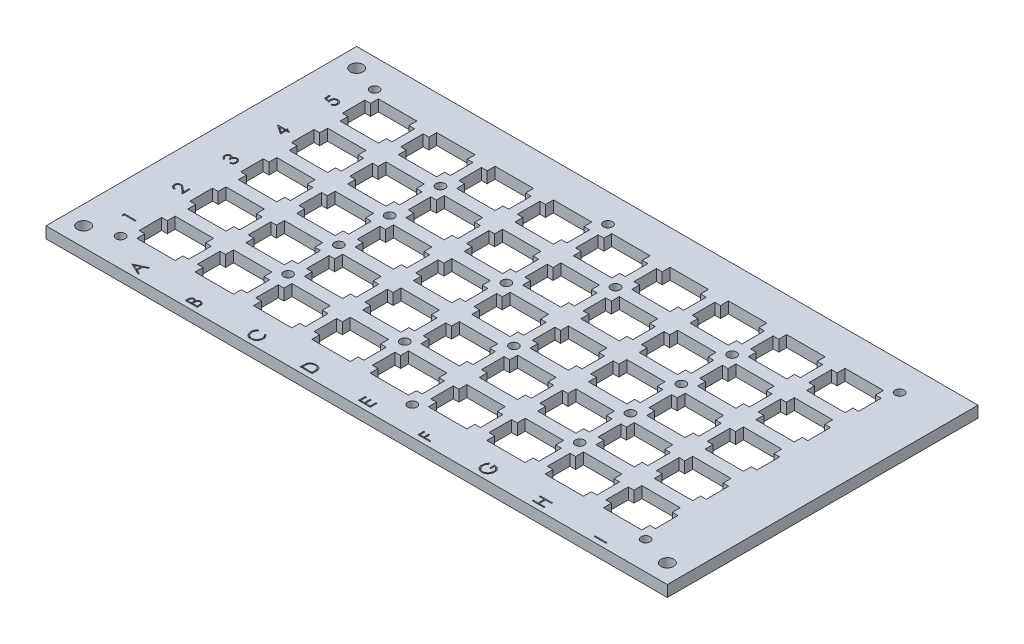
from build123d import *

# Parameters (mm, degrees)
SKETCH1_W                 = 195.1
SKETCH1_H                 = 112.55
BOSS_EXTRUDE1_DEPTH       = 8
SKETCH2_W                 = 10.2
SKETCH2_H                 = 10.2
SKETCH2_W_2               = 1.5
SKETCH2_H_2               = 6
CUT_EXTRUDE1_DEPTH        = 3
SKETCH3_R                 = 1.25
CUT_EXTRUDE2_DEPTH        = 224.844011906
LPATTERN1_COUNT           = 9
LPATTERN1_PITCH           = 15.5
LPATTERN1_COUNT_DIR2      = 5
LPATTERN1_PITCH_DIR2      = 13.5
CUT_EXTRUDE4_DEPTH        = 224.931109197
CUT_EXTRUDE4_DEPTH_BACK   = 224.931109197
SKETCH5_W                 = 195.1
SKETCH5_H                 = 112.55
SKETCH5_W_2               = 165.1
SKETCH5_H_2               = 82.55
F_1_8_0_133_DOWEL_HOLE1_D = 3.3782
M2_CLEARANCE_HOLE1_D      = 2.4
SKETCH14_W                = 3.175
SKETCH14_H                = 0.284935898
CUT_EXTRUDE7_DEPTH        = 0.8
SKETCH15_W                = 165.1
SKETCH15_H                = 82.55
CUT_EXTRUDE8_DEPTH        = 10


with BuildPart() as part:
    # Sketch1 → Boss-Extrude1 (new body)
    with BuildSketch(Plane(origin=(0, 0, 0), x_dir=(1, 0, 0), z_dir=(0, 1, 0))):
        with Locations((96.157910906, -55.789208909)):
            Rectangle(SKETCH1_W, SKETCH1_H)
    extrude(amount=BOSS_EXTRUDE1_DEPTH)

    # Sketch2 → Cut-Extrude1 (cut)
    with BuildSketch(Plane(origin=(0, 8, 0), x_dir=(1, 0, 0), z_dir=(0, 1, 0))):
        with Locations((20.857910906, -18.964208909)):
            Rectangle(SKETCH2_W, SKETCH2_H)
        with Locations((15.007910906, -18.964208909)):
            Rectangle(SKETCH2_W_2, SKETCH2_H_2)
        with Locations((26.707910906, -18.964208909)):
            Rectangle(SKETCH2_W_2, SKETCH2_H_2)
    cut_extrude1 = extrude(amount=-CUT_EXTRUDE1_DEPTH, mode=Mode.SUBTRACT)

    # Sketch3 → Cut-Extrude2 (cut, through all)
    with BuildSketch(Plane(origin=(0, 5, 0), x_dir=(1, 0, 0), z_dir=(0, 1, 0))):
        with Locations(Location((21.357910906, -18.964208909, 0), (0, 0, 270))):
            Circle(SKETCH3_R)
    cut_extrude2 = extrude(amount=-CUT_EXTRUDE2_DEPTH, mode=Mode.SUBTRACT)

    # LPattern1: Cut-Extrude1, Cut-Extrude2 9 × 5
    with Locations(*[(i * LPATTERN1_PITCH, 0, j * LPATTERN1_PITCH_DIR2) for i in range(LPATTERN1_COUNT) for j in range(LPATTERN1_COUNT_DIR2) if (i, j) != (0, 0)]):
        add(cut_extrude1, mode=Mode.SUBTRACT)
        add(cut_extrude2, mode=Mode.SUBTRACT)

    # Sketch5 → Cut-Extrude4 (cut, two sides: drawn at the far end of the back side and taken through both)
    with BuildSketch(Plane(origin=(0, 8, 0), x_dir=(1, 0, 0), z_dir=(0, 1, 0)).offset(-CUT_EXTRUDE4_DEPTH_BACK)):
        with Locations((96.157910906, -55.789208909)):
            Rectangle(SKETCH5_W, SKETCH5_H)
        with Locations((83.357910906, -45.964208909)):
            Rectangle(SKETCH5_W_2, SKETCH5_H_2, mode=Mode.SUBTRACT)
    extrude(amount=CUT_EXTRUDE4_DEPTH + CUT_EXTRUDE4_DEPTH_BACK, mode=Mode.SUBTRACT)

    # 1/8 (0.133) Dowel Hole1 (through all)
    with Locations(Plane(origin=(0, 8, 0), x_dir=(1, 0, 0), z_dir=(0, 1, 0))):
        with Locations((5.807910906, -9.689208909), (5.807910906, -82.239208909), (160.907910906, -82.239208909)):
            Hole(F_1_8_0_133_DOWEL_HOLE1_D / 2)

    # M2 Clearance Hole1 (through all)
    with Locations(Plane(origin=(0, 8, 0), x_dir=(1, 0, 0), z_dir=(0, 1, 0))):
        with Locations((13.107910906, -79.714208909), (13.107910906, -12.214208909), (44.107910906, -66.214208909), (44.107910906, -52.714208909), (44.107910906, -39.214208909), (44.107910906, -25.714208909), (152.607910906, -79.714208909), (152.607910906, -12.214208909), (121.607910906, -66.214208909), (121.607910906, -52.714208909), (121.607910906, -39.214208909), (121.607910906, -25.714208909), (90.607910906, -25.714208909), (75.107910906, -39.214208909), (90.607910906, -52.714208909), (75.107910906, -66.214208909), (90.607910906, -79.714208909), (75.107910906, -12.214208909)):
            Hole(M2_CLEARANCE_HOLE1_D / 2)

    # Sketch14 → Cut-Extrude7 (cut)
    # profile 1 of 14: a face of its own
    with BuildSketch(Plane(origin=(0, 8, 0), x_dir=(1, 0, 0), z_dir=(0, 1, 0))):
        Polygon((8.415036229, -74.632838521), (8.415036229, -74.04579425), (11.590036229, -74.04579425), (11.590036229, -74.330730148), (8.740677255, -74.330730148), (8.740677255, -74.819191686), align=None)
    # profile 2 of 14: a face of its own
    with BuildSketch(Plane(origin=(0, 8, 0), x_dir=(1, 0, 0), z_dir=(0, 1, 0))):
        with BuildLine():
            Line((9.391959306, -61.467909635), (9.391959306, -61.752845532))
            add(Edge.make_bspline(
                [(9.391959306, -61.752845532), (9.354157858, -61.750988472), (9.27991682, -61.747341255), (9.17167299, -61.730261307), (9.068208994, -61.705822083), (8.970355572, -61.671267692), (8.877247512, -61.62835414), (8.78925464, -61.576891901), (8.706712633, -61.51593748), (8.630386683, -61.446807085), (8.560366529, -61.371724106), (8.499900702, -61.290710861), (8.448812528, -61.205580014), (8.406103116, -61.116589845), (8.374044827, -61.022736334), (8.350258054, -60.92487117), (8.335946655, -60.822564382), (8.334408335, -60.752859505), (8.333625973, -60.717408834)],
                knots=[0, 0, 0, 0, 1.10065271, 2.161652631, 3.183658789, 4.190468796, 5.17591951, 6.163126047, 7.15150782, 8.156236427, 9.156009102, 10.134482811, 11.092018607, 12.041330605, 13.001268258, 13.972401359, 14.968799086, 16, 16, 16, 16], degree=3))
            add(Edge.make_bspline(
                [(8.333625973, -60.717408834), (8.334434387, -60.682591988), (8.336022892, -60.61417813), (8.349869677, -60.514370819), (8.371088641, -60.419130707), (8.402531803, -60.329537151), (8.441986092, -60.244670667), (8.491052671, -60.165582045), (8.547409872, -60.090358838), (8.613885955, -60.022692871), (8.684816104, -59.960533517), (8.760568906, -59.906955912), (8.838899636, -59.860814457), (8.92042017, -59.823049118), (9.00539598, -59.794421311), (9.093012373, -59.77321085), (9.184280502, -59.761085804), (9.246064654, -59.75923514), (9.277476133, -59.75829425)],
                knots=[0, 0, 0, 0, 1.111674182, 2.184400057, 3.212814286, 4.223731311, 5.211378316, 6.196328225, 7.191884489, 8.207283132, 9.220262353, 10.201199469, 11.166417575, 12.120932471, 13.06540007, 14.026332106, 14.996573967, 16, 16, 16, 16], degree=3))
            add(Edge.make_bspline(
                [(9.277476133, -59.75829425), (9.321697364, -59.759830306), (9.409363806, -59.762875461), (9.538191853, -59.788923149), (9.663007678, -59.829606688), (9.763465655, -59.878585663), (9.844405518, -59.928009668), (9.911080305, -59.972503325), (9.982852234, -60.024886735), (10.0600118, -60.084712357), (10.141548533, -60.153010472), (10.229126002, -60.228006704), (10.32112484, -60.311637858), (10.384002221, -60.370283403), (10.416583705, -60.400672055)],
                knots=[0, 0, 0, 0, 1.184416499, 2.348048165, 3.509039915, 4.696071444, 5.333504901, 6.05069495, 6.844171097, 7.714965912, 8.667477798, 9.695072654, 10.805644396, 12, 12, 12, 12], degree=3))
            Line((10.416583705, -60.400672055), (11.264395204, -61.195058072))
            Line((11.264395204, -61.195058072), (11.264395204, -59.717589122))
            Line((11.264395204, -59.717589122), (11.590036229, -59.717589122))
            Line((11.590036229, -59.717589122), (11.590036229, -61.874960917))
            Line((11.590036229, -61.874960917), (10.276023809, -60.643630789))
            add(Edge.make_bspline(
                [(10.276023809, -60.643630789), (10.244728917, -60.613651634), (10.184617833, -60.556067814), (10.096858148, -60.474622191), (10.015442493, -60.401471108), (9.940524696, -60.336141045), (9.871008916, -60.280049222), (9.809146578, -60.230272269), (9.752219327, -60.190389197), (9.686233199, -60.147104517), (9.605667739, -60.105181834), (9.507212178, -60.069157054), (9.405859599, -60.047190727), (9.337368466, -60.044555626), (9.302916838, -60.043230148)],
                knots=[0, 0, 0, 0, 1.329631726, 2.553950428, 3.673215718, 4.687767853, 5.603093632, 6.413772471, 7.123043292, 7.734684054, 8.834405432, 9.900288307, 10.943827018, 12, 12, 12, 12], degree=3))
            add(Edge.make_bspline(
                [(9.302916838, -60.043230148), (9.281252998, -60.043806857), (9.23855773, -60.04494344), (9.175959648, -60.054974351), (9.115575853, -60.070133167), (9.057220606, -60.091854937), (9.001480621, -60.120526766), (8.94828805, -60.155427617), (8.89686306, -60.195695746), (8.848645425, -60.242278683), (8.804484617, -60.293451991), (8.765364911, -60.347512489), (8.73267229, -60.40470794), (8.705872117, -60.464797194), (8.684848736, -60.527612727), (8.67028131, -60.593276031), (8.661135057, -60.661605675), (8.659897558, -60.708263203), (8.659266998, -60.732037239)],
                knots=[0, 0, 0, 0, 0.991446411, 1.95395049, 2.89581595, 3.838931463, 4.798493298, 5.75982156, 6.748411868, 7.785213223, 8.824556874, 9.840280684, 10.836137867, 11.835679398, 12.848801643, 13.863922112, 14.911575587, 16, 16, 16, 16], degree=3))
            add(Edge.make_bspline(
                [(8.659266998, -60.732037239), (8.659890041, -60.756872726), (8.661113593, -60.805645523), (8.670381387, -60.87710279), (8.684431366, -60.945740612), (8.7067458, -61.01053485), (8.733111414, -61.072888584), (8.766606084, -61.131470659), (8.805527634, -61.187253717), (8.85065876, -61.239320236), (8.901366841, -61.286873539), (8.957250648, -61.329242844), (9.017907861, -61.366019396), (9.08308953, -61.39815141), (9.153444623, -61.424233903), (9.228707408, -61.444167547), (9.308555593, -61.459939661), (9.363696318, -61.465208852), (9.391959306, -61.467909635)],
                knots=[0, 0, 0, 0, 1.030878251, 2.024474673, 2.987898669, 3.934362936, 4.864849709, 5.795128259, 6.730474222, 7.685293701, 8.650606017, 9.611896181, 10.591709709, 11.591680886, 12.625074257, 13.701333388, 14.821793024, 16, 16, 16, 16], degree=3))
        make_face()
    # profile 3 of 14: a face of its own
    with BuildSketch(Plane(origin=(0, 8, 0), x_dir=(1, 0, 0), z_dir=(0, 1, 0))):
        with BuildLine():
            Line((9.147728537, -48.035217327), (9.147728537, -48.320153225))
            add(Edge.make_bspline(
                [(9.147728537, -48.320153225), (9.115767641, -48.312433847), (9.053286703, -48.297343094), (8.964017259, -48.265867438), (8.879540922, -48.231578113), (8.801439484, -48.190403711), (8.728143336, -48.145492199), (8.661314916, -48.094036587), (8.599254583, -48.038410839), (8.544179003, -47.97688392), (8.494306349, -47.912360063), (8.451783976, -47.843930087), (8.415204208, -47.772970747), (8.385068712, -47.698990405), (8.362366987, -47.621768807), (8.345896171, -47.542004077), (8.335199946, -47.459487188), (8.334156039, -47.403473302), (8.333625973, -47.375031029)],
                knots=[0, 0, 0, 0, 1.162005537, 2.271625781, 3.343758855, 4.383309926, 5.390229558, 6.379919256, 7.361854164, 8.333198761, 9.295911338, 10.242430842, 11.177959212, 12.116337295, 13.062827104, 14.020064771, 14.994644689, 16, 16, 16, 16], degree=3))
            add(Edge.make_bspline(
                [(8.333625973, -47.375031029), (8.334877132, -47.333590256), (8.337352158, -47.251612653), (8.359953111, -47.131177603), (8.395717338, -47.015038989), (8.445132791, -46.904468028), (8.506081282, -46.801762736), (8.578620722, -46.710380624), (8.661351517, -46.631560332), (8.752730343, -46.565434718), (8.850389269, -46.51365954), (8.950900841, -46.475481187), (9.054026629, -46.452238662), (9.123656446, -46.449226443), (9.158540837, -46.447717327)],
                knots=[0, 0, 0, 0, 1.083050992, 2.142477498, 3.193116406, 4.255571735, 5.30263384, 6.308962982, 7.297363603, 8.282367274, 9.249857812, 10.179914175, 11.08814088, 12, 12, 12, 12], degree=3))
            add(Edge.make_bspline(
                [(9.158540837, -46.447717327), (9.192111286, -46.448772871), (9.257803446, -46.450838405), (9.353707947, -46.468376838), (9.444097113, -46.497891876), (9.529351453, -46.53877659), (9.608930415, -46.59170071), (9.683013044, -46.655810942), (9.751927924, -46.731559785), (9.791406303, -46.788962822), (9.811730941, -46.818515604)],
                knots=[0, 0, 0, 0, 1.024540389, 2.004866551, 2.965041327, 3.920577974, 4.882998113, 5.874504559, 6.905732034, 8, 8, 8, 8], degree=3))
            add(Edge.make_bspline(
                [(9.811730941, -46.818515604), (9.827980588, -46.784698034), (9.860228017, -46.717587059), (9.924475013, -46.627034769), (9.996833076, -46.543578999), (10.053930783, -46.497584332), (10.08267445, -46.474430068)],
                knots=[0, 0, 0, 0, 1.015663554, 2.015584519, 3.001021554, 4, 4, 4, 4], degree=3))
            add(Edge.make_bspline(
                [(10.08267445, -46.474430068), (10.103591125, -46.459152564), (10.145081949, -46.428847737), (10.211789993, -46.391441217), (10.279237415, -46.357505806), (10.349232019, -46.331062393), (10.420962539, -46.310584671), (10.494552141, -46.295946985), (10.570060919, -46.286853657), (10.621144383, -46.285551406), (10.646822087, -46.284896814)],
                knots=[0, 0, 0, 0, 1.025084078, 2.033381695, 3.024893161, 4.013698104, 4.991890475, 5.976764909, 6.982997093, 8, 8, 8, 8], degree=3))
            add(Edge.make_bspline(
                [(10.646822087, -46.284896814), (10.691280678, -46.286524929), (10.779988637, -46.289773497), (10.911051258, -46.318802245), (11.039149672, -46.363822263), (11.161733165, -46.427683796), (11.276316335, -46.505865122), (11.379594656, -46.59784889), (11.466976936, -46.704950119), (11.54087167, -46.823287276), (11.599390442, -46.952046181), (11.641568645, -47.089201596), (11.666867096, -47.233959783), (11.669902643, -47.332952671), (11.671446486, -47.383299258)],
                knots=[0, 0, 0, 0, 0.955697303, 1.906897079, 2.875188111, 3.870982192, 4.871999088, 5.854111427, 6.836107184, 7.836239895, 8.848948182, 9.870701427, 10.917064451, 12, 12, 12, 12], degree=3))
            add(Edge.make_bspline(
                [(11.671446486, -47.383299258), (11.670652023, -47.417241773), (11.669088785, -47.484029322), (11.658592458, -47.582252069), (11.638900582, -47.675811593), (11.614135322, -47.765616397), (11.579894577, -47.850311106), (11.539073264, -47.931113975), (11.490624576, -48.007670818), (11.434467036, -48.079526987), (11.371607068, -48.146605715), (11.301000392, -48.207198056), (11.223964772, -48.261974401), (11.139807262, -48.310586709), (11.048763574, -48.353239568), (10.95046888, -48.389015087), (10.845685203, -48.420251534), (10.772683652, -48.434802767), (10.735228537, -48.442268609)],
                knots=[0, 0, 0, 0, 1.048603596, 2.063302207, 3.045874044, 3.999447474, 4.937100059, 5.862643889, 6.7929026, 7.7308982, 8.676022965, 9.627908155, 10.600123445, 11.591992905, 12.626222643, 13.701663232, 14.820785756, 16, 16, 16, 16], degree=3))
            Line((10.735228537, -48.442268609), (10.735228537, -48.157332712))
            add(Edge.make_bspline(
                [(10.735228537, -48.157332712), (10.759675142, -48.149909297), (10.807225912, -48.135470112), (10.875661046, -48.110891713), (10.93839728, -48.08288978), (10.995894827, -48.052850145), (11.048719935, -48.021301126), (11.095475773, -47.98599973), (11.138215992, -47.949560577), (11.162295747, -47.922092877), (11.1740807, -47.908649819)],
                knots=[0, 0, 0, 0, 1.198163088, 2.33053128, 3.407730985, 4.417276592, 5.372219308, 6.28897303, 7.162600585, 8, 8, 8, 8], degree=3))
            add(Edge.make_bspline(
                [(11.1740807, -47.908649819), (11.187780466, -47.890870939), (11.21513771, -47.855368059), (11.250149003, -47.797550963), (11.280117833, -47.736532344), (11.304477754, -47.671803352), (11.32276319, -47.603355302), (11.335924186, -47.531465849), (11.344612488, -47.45601704), (11.345402003, -47.404524702), (11.34580546, -47.378211117)],
                knots=[0, 0, 0, 0, 0.946083416, 1.889246487, 2.84504177, 3.809995578, 4.801312957, 5.829064617, 6.89060985, 8, 8, 8, 8], degree=3))
            add(Edge.make_bspline(
                [(11.34580546, -47.378211117), (11.345246746, -47.348499011), (11.344154229, -47.290399553), (11.334106981, -47.205622645), (11.319474391, -47.124970889), (11.296874757, -47.049339735), (11.268952127, -46.977738489), (11.233892502, -46.91117085), (11.192758362, -46.848762953), (11.146004982, -46.791314135), (11.094822626, -46.739656425), (11.04128934, -46.694172724), (10.985630838, -46.655506067), (10.927539114, -46.624315249), (10.867254727, -46.599685821), (10.804608504, -46.582918918), (10.740113127, -46.571260758), (10.696271848, -46.570311331), (10.674170845, -46.569832712)],
                knots=[0, 0, 0, 0, 1.217147791, 2.380027433, 3.494444702, 4.572153297, 5.609568379, 6.639424714, 7.649109417, 8.668170816, 9.669597737, 10.625200337, 11.543417969, 12.441394052, 13.322311151, 14.205496177, 15.095365482, 16, 16, 16, 16], degree=3))
            add(Edge.make_bspline(
                [(10.674170845, -46.569832712), (10.644589594, -46.571223835), (10.585574284, -46.57399916), (10.49871643, -46.595099617), (10.414999315, -46.630119306), (10.335507224, -46.678184493), (10.262731493, -46.738125424), (10.197333907, -46.807108163), (10.143422277, -46.887009391), (10.106139901, -46.960494178), (10.080707584, -47.025597136), (10.063766413, -47.08130926), (10.049421263, -47.143681445), (10.036075102, -47.211958738), (10.024716459, -47.28665581), (10.015244238, -47.367691275), (10.007665023, -47.455081574), (10.004280387, -47.515579989), (10.002536229, -47.546755789)],
                knots=[0, 0, 0, 0, 1.070505987, 2.135685285, 3.216438728, 4.346150463, 5.486482244, 6.621737109, 7.7759408, 8.963942283, 9.59839197, 10.305095457, 11.070459627, 11.915156775, 12.823989992, 13.805807174, 14.869297358, 16, 16, 16, 16], degree=3))
            Line((10.002536229, -47.546755789), (9.676895204, -47.546755789))
            add(Edge.make_bspline(
                [(9.676895204, -47.546755789), (9.676132553, -47.507489641), (9.674639231, -47.430603798), (9.66020213, -47.317995864), (9.637024906, -47.210772814), (9.603908655, -47.110476009), (9.56490171, -47.019235588), (9.519830262, -46.939759229), (9.468816662, -46.87413918), (9.41283762, -46.821689885), (9.353125734, -46.781824737), (9.290509191, -46.753154875), (9.224739758, -46.736067612), (9.179838312, -46.733795361), (9.157268801, -46.732653225)],
                knots=[0, 0, 0, 0, 1.322091412, 2.58874672, 3.817242262, 5.011895168, 6.140903042, 7.155122731, 8.080855046, 8.929742606, 9.727943956, 10.488587771, 11.240295418, 12, 12, 12, 12], degree=3))
            add(Edge.make_bspline(
                [(9.157268801, -46.732653225), (9.140685516, -46.733020927), (9.107693858, -46.733752454), (9.05934256, -46.743344622), (9.012471484, -46.757096009), (8.967615039, -46.777061371), (8.924681419, -46.802929585), (8.883199646, -46.834131734), (8.843705722, -46.871557091), (8.805995894, -46.913473896), (8.771690388, -46.959889475), (8.741667393, -47.009721112), (8.716198625, -47.062766745), (8.695127019, -47.118686579), (8.679293706, -47.177741207), (8.667920575, -47.23963141), (8.660811073, -47.304481238), (8.659787387, -47.348724127), (8.659266998, -47.371214923)],
                knots=[0, 0, 0, 0, 0.884325644, 1.759323928, 2.622595547, 3.489424008, 4.37295195, 5.294616785, 6.255907374, 7.274251867, 8.302369084, 9.333474657, 10.37669385, 11.44084034, 12.520297356, 13.637342342, 14.798947025, 16, 16, 16, 16], degree=3))
            add(Edge.make_bspline(
                [(8.659266998, -47.371214923), (8.660529163, -47.407366079), (8.662994463, -47.477977695), (8.684587196, -47.579772655), (8.719038743, -47.674405194), (8.760162268, -47.746739556), (8.800757305, -47.800154463), (8.836210612, -47.838324256), (8.875610388, -47.875807862), (8.921383343, -47.910139298), (8.970429645, -47.944859262), (9.025242556, -47.976468257), (9.084392257, -48.007183835), (9.126207583, -48.025691863), (9.147728537, -48.035217327)],
                knots=[0, 0, 0, 0, 1.472543308, 2.876219568, 4.221790263, 5.565193594, 6.249813518, 6.953379497, 7.687249741, 8.463570142, 9.283606569, 10.136032583, 11.040678096, 12, 12, 12, 12], degree=3))
        make_face()
    # profile 4 of 14: a face of its own
    with BuildSketch(Plane(origin=(0, 8, 0), x_dir=(1, 0, 0), z_dir=(0, 1, 0))):
        Polygon((8.333625973, -33.276428265), (8.333625973, -33.218550661), (10.531702896, -33.218550661), (10.531702896, -32.852204507), (10.857343922, -32.852204507), (10.857343922, -33.218550661), (11.590036229, -33.218550661), (11.590036229, -33.503486558), (10.857343922, -33.503486558), (10.857343922, -35.009576302), align=None)
        Polygon((10.531702896, -33.503486558), (9.152816678, -33.503486558), (10.531702896, -34.449880789), align=None, mode=Mode.SUBTRACT)
    # profile 5 of 14: a face of its own
    with BuildSketch(Plane(origin=(0, 8, 0), x_dir=(1, 0, 0), z_dir=(0, 1, 0))):
        with BuildLine():
            Line((8.415036229, -19.582332712), (8.740677255, -19.582332712))
            Line((8.740677255, -19.582332712), (8.740677255, -20.662290645))
            Line((8.740677255, -20.662290645), (9.575768401, -20.833379387))
            add(Edge.make_bspline(
                [(9.575768401, -20.833379387), (9.566488083, -20.799764415), (9.548508934, -20.734640724), (9.528546557, -20.638519993), (9.516512904, -20.547268494), (9.514869787, -20.488054408), (9.514074691, -20.459401021)],
                knots=[0, 0, 0, 0, 1.100273476, 2.13160584, 3.095893838, 4, 4, 4, 4], degree=3))
            add(Edge.make_bspline(
                [(9.514074691, -20.459401021), (9.514816732, -20.423939978), (9.516275772, -20.354214707), (9.531117684, -20.252356801), (9.552614986, -20.154632718), (9.585735649, -20.062485344), (9.626181885, -19.974456815), (9.677124803, -19.892058915), (9.736600534, -19.814135186), (9.804302765, -19.741224196), (9.879587113, -19.675390119), (9.960867589, -19.618182476), (10.046370516, -19.568250816), (10.138099907, -19.529308602), (10.234325716, -19.497527956), (10.336158713, -19.47657172), (10.44269485, -19.462573861), (10.515543413, -19.461013176), (10.552691478, -19.460217327)],
                knots=[0, 0, 0, 0, 1.052805225, 2.070078116, 3.052532748, 4.020689046, 4.973125432, 5.925915817, 6.89216474, 7.881560752, 8.877013184, 9.857446635, 10.830895175, 11.812622661, 12.812548702, 13.836681939, 14.896847428, 16, 16, 16, 16], degree=3))
            add(Edge.make_bspline(
                [(10.552691478, -19.460217327), (10.578565044, -19.460821189), (10.629962519, -19.462020752), (10.7062957, -19.468107503), (10.781001738, -19.479871687), (10.853943673, -19.495474651), (10.92518982, -19.516303836), (10.995139082, -19.540667355), (11.063025522, -19.570949596), (11.129148965, -19.604520843), (11.192752651, -19.641694672), (11.252311566, -19.683495817), (11.309184858, -19.726929615), (11.361683476, -19.774389058), (11.410011055, -19.825334558), (11.454406514, -19.879482649), (11.495666617, -19.936342199), (11.532104354, -19.996808741), (11.565635186, -20.059530657), (11.593142926, -20.125414877), (11.617736059, -20.192961356), (11.637338984, -20.263142354), (11.652699231, -20.335798883), (11.663131919, -20.411050715), (11.670730544, -20.48850318), (11.671206211, -20.541004085), (11.671446486, -20.567524018)],
                knots=[0, 0, 0, 0, 1.056393913, 2.098511576, 3.122979385, 4.141471433, 5.141222888, 6.151259816, 7.162667642, 8.172852865, 9.177685681, 10.166741883, 11.141342384, 12.097242845, 13.052202613, 14.005160326, 14.953864445, 15.917140761, 16.884916217, 17.854238259, 18.828761908, 19.81781811, 20.826036654, 21.857789401, 22.917898972, 24, 24, 24, 24], degree=3))
            add(Edge.make_bspline(
                [(11.671446486, -20.567524018), (11.670818112, -20.599159075), (11.66958186, -20.661397313), (11.656707687, -20.752595327), (11.638146972, -20.840287298), (11.610648266, -20.924097391), (11.574640669, -21.00367607), (11.531858198, -21.080162884), (11.48092632, -21.152609813), (11.422310892, -21.220521559), (11.357904887, -21.282947507), (11.288681048, -21.339555817), (11.214551216, -21.389324973), (11.135756439, -21.432435512), (11.052436478, -21.469161762), (10.964334605, -21.498025602), (10.871896041, -21.521318688), (10.808256882, -21.53117348), (10.775933665, -21.536178866)],
                knots=[0, 0, 0, 0, 1.046872515, 2.059598001, 3.044168548, 4.012104806, 4.973680974, 5.932408326, 6.910122221, 7.900780896, 8.89867654, 9.876692837, 10.858029398, 11.85084981, 12.847361615, 13.868568023, 14.917415949, 16, 16, 16, 16], degree=3))
            Line((10.775933665, -21.536178866), (10.775933665, -21.251242968))
            add(Edge.make_bspline(
                [(10.775933665, -21.251242968), (10.806214028, -21.244236449), (10.864414567, -21.230769529), (10.946134619, -21.201133089), (11.018982888, -21.16524927), (11.083404782, -21.121584913), (11.140579528, -21.070972333), (11.190990373, -21.012137824), (11.236525131, -20.946552229), (11.27454576, -20.873633929), (11.306573012, -20.796555758), (11.329428711, -20.716343376), (11.343263757, -20.634151195), (11.344955037, -20.578813104), (11.34580546, -20.55098756)],
                knots=[0, 0, 0, 0, 1.13623081, 2.183898708, 3.172478118, 4.09966615, 5.022692284, 5.957376522, 6.927682873, 7.937366477, 8.960015386, 9.976409503, 10.982481913, 12, 12, 12, 12], degree=3))
            add(Edge.make_bspline(
                [(11.34580546, -20.55098756), (11.345054667, -20.523813276), (11.343576351, -20.47030689), (11.332381746, -20.391523493), (11.314687899, -20.315683398), (11.289899833, -20.242651979), (11.257106674, -20.172788098), (11.216822169, -20.106190535), (11.170051379, -20.04191055), (11.116594074, -19.981639894), (11.057650633, -19.926452732), (10.994626449, -19.87768749), (10.927391426, -19.837068632), (10.85711233, -19.802838352), (10.783018177, -19.776845731), (10.705456406, -19.758302837), (10.624235386, -19.747414349), (10.568836798, -19.745916493), (10.540607143, -19.745153225)],
                knots=[0, 0, 0, 0, 1.027268864, 2.022700798, 3.002744649, 3.968653148, 4.933396556, 5.915045722, 6.907600446, 7.935526002, 8.956456544, 9.95700807, 10.942805781, 11.92166854, 12.907987664, 13.905483474, 14.932689774, 16, 16, 16, 16], degree=3))
            add(Edge.make_bspline(
                [(10.540607143, -19.745153225), (10.515135414, -19.74573241), (10.465488383, -19.746861302), (10.392598863, -19.756634047), (10.323521039, -19.772959263), (10.257954341, -19.796203054), (10.196108402, -19.825212048), (10.138119513, -19.86163372), (10.083442427, -19.903917203), (10.033484214, -19.953282211), (9.987302499, -20.00698112), (9.94807656, -20.066393194), (9.914718091, -20.129932351), (9.887386722, -20.197716337), (9.865615193, -20.269828648), (9.850568593, -20.346308123), (9.841564936, -20.427172193), (9.840343544, -20.482485813), (9.839715716, -20.510918449)],
                knots=[0, 0, 0, 0, 1.045723156, 2.038222538, 3.013889863, 3.95567481, 4.890389958, 5.81331128, 6.76251276, 7.723027653, 8.692928204, 9.666105983, 10.639751036, 11.635719707, 12.66315958, 13.728667616, 14.832476222, 16, 16, 16, 16], degree=3))
            add(Edge.make_bspline(
                [(9.839715716, -20.510918449), (9.840242396, -20.535528263), (9.841329854, -20.586341285), (9.849336748, -20.664285564), (9.862253822, -20.746193055), (9.880021347, -20.831749776), (9.903272395, -20.921212666), (9.931134835, -21.014392929), (9.964446933, -21.111486486), (9.989604013, -21.176907564), (10.002536229, -21.21053784)],
                knots=[0, 0, 0, 0, 0.817624296, 1.688186739, 2.600797293, 3.572016777, 4.590301741, 5.671205678, 6.80286297, 8, 8, 8, 8], degree=3))
            Line((10.002536229, -21.21053784), (8.415036229, -20.884896814))
            Line((8.415036229, -20.884896814), (8.415036229, -19.582332712))
        make_face()
    # profile 6 of 14: a face of its own
    with BuildSketch(Plane(origin=(0, 8, 0), x_dir=(1, 0, 0), z_dir=(0, 1, 0))):
        Polygon((21.024347401, -84.602846105), (24.199347401, -83.13746149), (24.199347401, -83.447202075), (23.181719196, -83.916583084), (23.181719196, -85.355890977), (24.199347401, -85.838628357), (24.199347401, -86.149640977), (21.024347401, -84.643551233), align=None)
        Polygon((21.643192553, -84.626378758), (22.85607817, -85.201338693), (22.85607817, -84.066683245), align=None, mode=Mode.SUBTRACT)
    # profile 7 of 14: a face of its own
    with BuildSketch(Plane(origin=(0, 8, 0), x_dir=(1, 0, 0), z_dir=(0, 1, 0))):
        with BuildLine():
            Line((36.492296119, -85.905410208), (36.492296119, -85.285929038))
            add(Edge.make_bspline(
                [(36.492296119, -85.285929038), (36.49245304, -85.255604155), (36.492757192, -85.196826983), (36.497583857, -85.111362989), (36.504000451, -85.031286196), (36.514763943, -84.95673811), (36.525924265, -84.887233658), (36.542304945, -84.823478456), (36.560398004, -84.764938475), (36.588236629, -84.694643939), (36.631470366, -84.614885157), (36.695590106, -84.52915939), (36.772464496, -84.454641323), (36.860068927, -84.391278877), (36.956443729, -84.340429166), (37.059515366, -84.304107044), (37.167549782, -84.28077233), (37.241617362, -84.278402668), (37.279049925, -84.27720508)],
                knots=[0, 0, 0, 0, 1.00128172, 1.940733171, 2.826250472, 3.653024905, 4.427672124, 5.149348099, 5.824709082, 6.450061444, 7.643590664, 8.808605388, 9.972104426, 11.165284501, 12.367876273, 13.557044126, 14.765369432, 16, 16, 16, 16], degree=3))
            add(Edge.make_bspline(
                [(37.279049925, -84.27720508), (37.314111773, -84.278202584), (37.383011611, -84.280162773), (37.483611795, -84.298678439), (37.579276689, -84.328065447), (37.669924419, -84.368679478), (37.753867568, -84.421008384), (37.830846105, -84.483705769), (37.897950663, -84.559036176), (37.935451779, -84.615504103), (37.954500646, -84.644187251)],
                knots=[0, 0, 0, 0, 1.044641374, 2.052818814, 3.038628718, 4.023282556, 5.005660861, 5.98021751, 6.974042014, 8, 8, 8, 8], degree=3))
            add(Edge.make_bspline(
                [(37.954500646, -84.644187251), (37.968352665, -84.608122346), (37.994855008, -84.539121249), (38.041637578, -84.444110896), (38.092705224, -84.362551961), (38.147612065, -84.292851233), (38.207668668, -84.233553955), (38.273362964, -84.182199084), (38.344641173, -84.137801797), (38.421241325, -84.100020013), (38.502514045, -84.07034195), (38.587466667, -84.048528985), (38.675773526, -84.035626143), (38.735700329, -84.033865997), (38.76605914, -84.03297431)],
                knots=[0, 0, 0, 0, 1.272586185, 2.434772614, 3.483318042, 4.437947805, 5.351807173, 6.25737843, 7.180033415, 8.1141739, 9.066731021, 10.025721652, 10.999834114, 12, 12, 12, 12], degree=3))
            add(Edge.make_bspline(
                [(38.76605914, -84.03297431), (38.7970535, -84.033860256), (38.858035772, -84.035603378), (38.947618985, -84.048469404), (39.033237165, -84.070238927), (39.11540465, -84.100276589), (39.193949163, -84.1392104), (39.268586164, -84.187276368), (39.339470934, -84.243799745), (39.406728577, -84.307680297), (39.468271435, -84.378870175), (39.521177538, -84.457326002), (39.566669246, -84.540898471), (39.603706973, -84.630655977), (39.632281555, -84.726369387), (39.652190179, -84.827985441), (39.665627088, -84.935336792), (39.666730335, -85.009006177), (39.667296119, -85.04678641)],
                knots=[0, 0, 0, 0, 0.978680899, 1.925582087, 2.851223405, 3.764209995, 4.683484765, 5.614004905, 6.562443559, 7.542772147, 8.539900013, 9.527881485, 10.525548727, 11.540192123, 12.58875426, 13.674701727, 14.807505862, 16, 16, 16, 16], degree=3))
            Line((39.667296119, -85.04678641), (39.667296119, -85.905410208))
            Line((39.667296119, -85.905410208), (36.492296119, -85.905410208))
        make_face()
        with BuildLine():
            Line((36.817937145, -85.62047431), (37.83556535, -85.62047431))
            Line((37.83556535, -85.62047431), (37.83556535, -85.429033004))
            add(Edge.make_bspline(
                [(37.83556535, -85.429033004), (37.835202563, -85.40104874), (37.834501584, -85.346977438), (37.832493607, -85.268672961), (37.826871098, -85.195988121), (37.821250196, -85.129048396), (37.812111131, -85.067959148), (37.801232478, -85.012855887), (37.789727546, -84.962873269), (37.77015978, -84.905235173), (37.741250044, -84.839845557), (37.696340934, -84.770183125), (37.642893425, -84.708484878), (37.580645537, -84.657008964), (37.512846642, -84.614507911), (37.44009195, -84.584734587), (37.363845556, -84.564885598), (37.311401235, -84.563065223), (37.284774084, -84.562140977)],
                knots=[0, 0, 0, 0, 1.156917035, 2.235399477, 3.236897345, 4.169954739, 5.01148057, 5.788325709, 6.491867502, 7.129259015, 8.302032419, 9.437271567, 10.542795419, 11.662606952, 12.764338259, 13.836858145, 14.901724648, 16, 16, 16, 16], degree=3))
            add(Edge.make_bspline(
                [(37.284774084, -84.562140977), (37.267149824, -84.562610252), (37.232577914, -84.563530786), (37.182016317, -84.571343848), (37.134506962, -84.584003081), (37.089593878, -84.601147095), (37.048393262, -84.624568362), (37.008936444, -84.651716688), (36.973586693, -84.685235151), (36.940642135, -84.72311399), (36.911156865, -84.766454138), (36.886732889, -84.816189359), (36.864596652, -84.871033922), (36.848209854, -84.932475789), (36.833800234, -84.999241865), (36.824746573, -85.072236187), (36.818920456, -85.150996205), (36.818272226, -85.205567005), (36.817937145, -85.233775592)],
                knots=[0, 0, 0, 0, 0.911708768, 1.788416306, 2.640049961, 3.452993646, 4.268229297, 5.087074648, 5.92553149, 6.781184137, 7.681934069, 8.628939405, 9.643570426, 10.73771997, 11.914765019, 13.176320755, 14.540391495, 16, 16, 16, 16], degree=3))
            Line((36.817937145, -85.233775592), (36.817937145, -85.62047431))
        make_face(mode=Mode.SUBTRACT)
        with BuildLine():
            Line((38.161206376, -85.62047431), (39.341655094, -85.62047431))
            Line((39.341655094, -85.62047431), (39.341655094, -85.214695064))
            add(Edge.make_bspline(
                [(39.341655094, -85.214695064), (39.341272366, -85.185652362), (39.340534708, -85.129676382), (39.338804747, -85.048793039), (39.33226057, -84.97402231), (39.326223595, -84.905128321), (39.315900628, -84.842293916), (39.306158431, -84.78503577), (39.291696836, -84.734293815), (39.271821075, -84.674913987), (39.240002448, -84.608541065), (39.193515735, -84.536007409), (39.136143954, -84.472759184), (39.07089442, -84.418466488), (39.000144012, -84.373661797), (38.924817659, -84.341510193), (38.846380314, -84.32153004), (38.792886763, -84.319119248), (38.76605914, -84.317910208)],
                knots=[0, 0, 0, 0, 1.160376723, 2.23647316, 3.230273494, 4.158083346, 4.997711197, 5.773399541, 6.476071462, 7.102777513, 8.27340052, 9.405620712, 10.53304798, 11.669441455, 12.787990954, 13.865552736, 14.929550474, 16, 16, 16, 16], degree=3))
            add(Edge.make_bspline(
                [(38.76605914, -84.317910208), (38.749282677, -84.318159907), (38.716000357, -84.318655277), (38.667096274, -84.326160018), (38.619700484, -84.337016999), (38.573615482, -84.351315955), (38.529616125, -84.371305126), (38.487533676, -84.395810173), (38.446520398, -84.423860554), (38.393999342, -84.467136986), (38.334237667, -84.531001959), (38.276450033, -84.621761213), (38.229093627, -84.724387908), (38.209073365, -84.798995999), (38.198731416, -84.83753661)],
                knots=[0, 0, 0, 0, 0.723302347, 1.434937762, 2.129609326, 2.821140842, 3.513216847, 4.209993937, 4.920569932, 5.655069131, 7.14393391, 8.6716197, 10.280644748, 12, 12, 12, 12], degree=3))
            add(Edge.make_bspline(
                [(38.198731416, -84.83753661), (38.195597161, -84.852984433), (38.18880145, -84.886478499), (38.181628034, -84.941095375), (38.175237158, -85.003448628), (38.170509893, -85.073682238), (38.165623529, -85.151885065), (38.163723227, -85.238224127), (38.161456041, -85.332346834), (38.161291726, -85.3976542), (38.161206376, -85.431577075)],
                knots=[0, 0, 0, 0, 0.634451884, 1.375622551, 2.216452059, 3.157844607, 4.20941857, 5.370758133, 6.634282058, 8, 8, 8, 8], degree=3))
            Line((38.161206376, -85.431577075), (38.161206376, -85.62047431))
        make_face(mode=Mode.SUBTRACT)
    # profile 8 of 14: a face of its own
    with BuildSketch(Plane(origin=(0, 8, 0), x_dir=(1, 0, 0), z_dir=(0, 1, 0))):
        with BuildLine():
            Line((53.031298523, -82.974640977), (53.222103811, -83.223959887))
            add(Edge.make_bspline(
                [(53.222103811, -83.223959887), (53.200907819, -83.241745411), (53.158801603, -83.277076672), (53.099670324, -83.33391484), (53.044290821, -83.393162783), (52.99230727, -83.454738064), (52.945808999, -83.520065677), (52.901174684, -83.586656457), (52.862095805, -83.656929942), (52.814356066, -83.753611289), (52.765625856, -83.880580136), (52.723713669, -84.039860671), (52.697284807, -84.20636295), (52.694402966, -84.319930716), (52.692937145, -84.377695865)],
                knots=[0, 0, 0, 0, 0.75789156, 1.505565099, 2.245254514, 2.979266606, 3.711207489, 4.440978832, 5.174393176, 5.91211879, 7.394186119, 8.890401545, 10.418332761, 12, 12, 12, 12], degree=3))
            add(Edge.make_bspline(
                [(52.692937145, -84.377695865), (52.693303597, -84.409521429), (52.694033099, -84.472877187), (52.703657091, -84.566901159), (52.717183689, -84.659169427), (52.737254518, -84.749621971), (52.762629679, -84.838143656), (52.792951307, -84.925313188), (52.830466044, -85.009868533), (52.871930006, -85.092979308), (52.918763322, -85.172607797), (52.969848129, -85.247949846), (53.024609509, -85.318735074), (53.0832647, -85.385003333), (53.145505452, -85.446881808), (53.212029068, -85.503591847), (53.282124388, -85.555891142), (53.355849624, -85.603481626), (53.432518139, -85.646324115), (53.512567663, -85.682347985), (53.594627588, -85.71381099), (53.679279659, -85.739099082), (53.765961236, -85.758959555), (53.855031416, -85.772690172), (53.946321326, -85.782202629), (54.008196809, -85.782928787), (54.039386464, -85.783294823)],
                knots=[0, 0, 0, 0, 1.054877232, 2.099964208, 3.13098259, 4.145888998, 5.169474743, 6.183358035, 7.203388855, 8.234598956, 9.261847606, 10.264062591, 11.251197969, 12.227332808, 13.196685059, 14.158975844, 15.123498106, 16.094582253, 17.066912473, 18.032714859, 19.002806091, 19.979168736, 20.95977404, 21.949109834, 22.966205168, 24, 24, 24, 24], degree=3))
            add(Edge.make_bspline(
                [(54.039386464, -85.783294823), (54.086313115, -85.782147489), (54.17844737, -85.779894851), (54.313418417, -85.759931963), (54.442844896, -85.72935273), (54.565850471, -85.684273136), (54.683460543, -85.627578393), (54.79424885, -85.556838987), (54.899838472, -85.474600278), (54.99767209, -85.380018603), (55.087036849, -85.276233439), (55.165732354, -85.164884276), (55.231332195, -85.046244051), (55.285920398, -84.921623874), (55.327881852, -84.790064456), (55.357422166, -84.651802461), (55.376691858, -84.507138578), (55.378536703, -84.408287766), (55.379475606, -84.357979318)],
                knots=[0, 0, 0, 0, 1.029159485, 2.020618137, 2.987588728, 3.942669054, 4.889339625, 5.846988364, 6.821327795, 7.821533711, 8.827683044, 9.822769455, 10.807800696, 11.797391277, 12.803701919, 13.832062008, 14.896664671, 16, 16, 16, 16], degree=3))
            add(Edge.make_bspline(
                [(55.379475606, -84.357979318), (55.377943642, -84.302550451), (55.374928369, -84.193453179), (55.349383908, -84.033462184), (55.307965654, -83.880304025), (55.25000111, -83.733970464), (55.174649027, -83.594874035), (55.083301667, -83.462797065), (54.975090108, -83.337628069), (54.892464699, -83.262361262), (54.85030894, -83.223959887)],
                knots=[0, 0, 0, 0, 1.028121516, 2.023589091, 2.998037872, 3.967518031, 4.937445131, 5.927275754, 6.942489185, 8, 8, 8, 8], degree=3))
            Line((54.85030894, -83.223959887), (55.039206175, -82.974640977))
            add(Edge.make_bspline(
                [(55.039206175, -82.974640977), (55.065093732, -82.994705966), (55.116744846, -83.034739834), (55.189576042, -83.099552029), (55.258019349, -83.167878271), (55.321732964, -83.239894185), (55.380980606, -83.315726705), (55.435794462, -83.395368871), (55.485883632, -83.478752702), (55.531892994, -83.565215889), (55.572402677, -83.65495767), (55.608300174, -83.747188008), (55.638019337, -83.842472406), (55.663158413, -83.940008781), (55.681083706, -84.040678025), (55.695358005, -84.143309931), (55.703826577, -84.2488651), (55.704682756, -84.320015299), (55.705116632, -84.356071266)],
                knots=[0, 0, 0, 0, 0.986911346, 1.969095443, 2.935967484, 3.900112155, 4.865124501, 5.834589912, 6.812044781, 7.795288262, 8.784678562, 9.777857908, 10.776141921, 11.791195789, 12.811324908, 13.855933174, 14.913475973, 16, 16, 16, 16], degree=3))
            add(Edge.make_bspline(
                [(55.705116632, -84.356071266), (55.704878967, -84.390219449), (55.704409015, -84.457743254), (55.69679612, -84.557437121), (55.686409573, -84.654491955), (55.670770311, -84.748630366), (55.652315089, -84.840366072), (55.627576163, -84.928867459), (55.599863705, -85.0150054), (55.567292752, -85.098433823), (55.530538787, -85.179223694), (55.488999301, -85.257114437), (55.44302361, -85.332070229), (55.393625136, -85.404828004), (55.339217155, -85.474312955), (55.280555279, -85.541127224), (55.217837227, -85.605645471), (55.172611753, -85.645562192), (55.149873243, -85.665631562)],
                knots=[0, 0, 0, 0, 1.114604814, 2.203992996, 3.262667896, 4.300477797, 5.318619304, 6.316056647, 7.298880507, 8.271930387, 9.238335007, 10.195173496, 11.151986948, 12.108099108, 13.064862484, 14.031167946, 15.010108607, 16, 16, 16, 16], degree=3))
            add(Edge.make_bspline(
                [(55.149873243, -85.665631562), (55.110374349, -85.697774656), (55.031853428, -85.761672785), (54.904605999, -85.843460525), (54.771867206, -85.913236968), (54.632868203, -85.970283569), (54.487554953, -86.014102015), (54.336161224, -86.04490923), (54.17898966, -86.064789079), (54.072096365, -86.067070872), (54.017761864, -86.068230721)],
                knots=[0, 0, 0, 0, 0.994611881, 1.977215934, 2.950189954, 3.921972279, 4.908960509, 5.911694611, 6.938501887, 8, 8, 8, 8], degree=3))
            add(Edge.make_bspline(
                [(54.017761864, -86.068230721), (53.960652274, -86.066819938), (53.848292721, -86.064044311), (53.683397778, -86.040462411), (53.52541758, -86.002526789), (53.374647041, -85.948645325), (53.230293144, -85.880332614), (53.093458622, -85.795944186), (52.963268382, -85.696460421), (52.841697858, -85.582661556), (52.73053716, -85.45786833), (52.632741532, -85.32422912), (52.551354928, -85.182005497), (52.483322695, -85.032764303), (52.431030932, -84.875388006), (52.394424827, -84.710212379), (52.371640014, -84.537547792), (52.368759647, -84.41974402), (52.367296119, -84.359887371)],
                knots=[0, 0, 0, 0, 1.032925535, 2.032216505, 3.007276963, 3.968222605, 4.92396291, 5.891752235, 6.871517503, 7.883894988, 8.900124299, 9.891468569, 10.874487609, 11.85992873, 12.854644235, 13.869047385, 14.917252991, 16, 16, 16, 16], degree=3))
            add(Edge.make_bspline(
                [(52.367296119, -84.359887371), (52.367733868, -84.32340722), (52.368600347, -84.251198434), (52.377036834, -84.144378222), (52.391130161, -84.040387631), (52.410211601, -83.939117293), (52.434240824, -83.840274429), (52.464188933, -83.744043958), (52.499844262, -83.650661523), (52.540560995, -83.560157463), (52.586346727, -83.473142728), (52.636661404, -83.389671946), (52.691250798, -83.310077892), (52.750673781, -83.234774261), (52.814437446, -83.163668922), (52.881794891, -83.095707092), (52.954474559, -83.032867075), (53.005643658, -82.994085205), (53.031298523, -82.974640977)],
                knots=[0, 0, 0, 0, 1.096622143, 2.170653093, 3.219033441, 4.250379162, 5.267604342, 6.275621678, 7.278284436, 8.271072515, 9.257558938, 10.232633088, 11.19973724, 12.157384997, 13.114417402, 14.069920322, 15.032307892, 16, 16, 16, 16], degree=3))
        make_face()
    # profile 9 of 14: a face of its own
    with BuildSketch(Plane(origin=(0, 8, 0), x_dir=(1, 0, 0), z_dir=(0, 1, 0))):
        with BuildLine():
            Line((70.196142273, -85.905410208), (67.021142273, -85.905410208))
            Line((67.021142273, -85.905410208), (67.021142273, -85.264304439))
            add(Edge.make_bspline(
                [(67.021142273, -85.264304439), (67.021543747, -85.208543285), (67.022319393, -85.100813026), (67.02723737, -84.945136021), (67.035937292, -84.801096465), (67.048609648, -84.669168085), (67.0641699, -84.5489887), (67.083673838, -84.44089482), (67.106704536, -84.344327519), (67.126340051, -84.284937383), (67.135625446, -84.256852516)],
                knots=[0, 0, 0, 0, 1.314313732, 2.53924729, 3.670748893, 4.714932338, 5.66265055, 6.526160246, 7.303039223, 8, 8, 8, 8], degree=3))
            add(Edge.make_bspline(
                [(67.135625446, -84.256852516), (67.149618941, -84.220114694), (67.177288606, -84.147472142), (67.229563675, -84.044099423), (67.288550322, -83.946453937), (67.355605991, -83.855314201), (67.429855049, -83.770451536), (67.510767062, -83.690902774), (67.600139454, -83.618629193), (67.696381451, -83.55250513), (67.798259921, -83.492869616), (67.905608014, -83.441037285), (68.017873143, -83.39798945), (68.13474512, -83.362254243), (68.25648038, -83.33409065), (68.383220823, -83.314875618), (68.514465514, -83.302201932), (68.603523778, -83.300928257), (68.648711384, -83.300282003)],
                knots=[0, 0, 0, 0, 0.984741985, 1.947153288, 2.898543998, 3.841229145, 4.778974371, 5.722123648, 6.681464302, 7.655713756, 8.646344578, 9.637374342, 10.639946623, 11.656849581, 12.698333139, 13.76849723, 14.867749466, 16, 16, 16, 16], degree=3))
            add(Edge.make_bspline(
                [(68.648711384, -83.300282003), (68.687955507, -83.300852567), (68.76529015, -83.301976922), (68.879264396, -83.312072795), (68.989857403, -83.326747051), (69.096542642, -83.349465633), (69.200254421, -83.37704536), (69.299888862, -83.412390296), (69.396354573, -83.452885157), (69.488366904, -83.500086795), (69.575483957, -83.551976821), (69.657668895, -83.607315977), (69.733098007, -83.667359313), (69.803747877, -83.730329726), (69.867731174, -83.797745741), (69.926214227, -83.868786577), (69.978217904, -83.943728317), (70.024559391, -84.023034873), (70.066001302, -84.107765403), (70.100568827, -84.200585112), (70.130507833, -84.301054331), (70.154324313, -84.40974601), (70.173532476, -84.526272481), (70.186321344, -84.65095699), (70.194994613, -84.783563899), (70.195752292, -84.874622548), (70.196142273, -84.921490937)],
                knots=[0, 0, 0, 0, 1.106010661, 2.179509527, 3.223302912, 4.248870533, 5.252098245, 6.246278179, 7.226402005, 8.199283979, 9.158616973, 10.083547221, 10.989831858, 11.874256832, 12.749262829, 13.607058236, 14.46581075, 15.317568432, 16.194266721, 17.121067875, 18.106207572, 19.147242834, 20.255495536, 21.43354536, 22.679031616, 24, 24, 24, 24], degree=3))
            Line((70.196142273, -84.921490937), (70.196142273, -85.905410208))
        make_face()
        with BuildLine():
            Line((69.870501247, -85.62047431), (69.870501247, -85.256036209))
            add(Edge.make_bspline(
                [(69.870501247, -85.256036209), (69.870276189, -85.20366833), (69.869843318, -85.10294572), (69.866044927, -84.958113108), (69.859838312, -84.825779656), (69.851152348, -84.705926572), (69.839660105, -84.598621529), (69.8268468, -84.50364027), (69.810883398, -84.421294143), (69.796413599, -84.371465297), (69.789727009, -84.348439054)],
                knots=[0, 0, 0, 0, 1.375205317, 2.645023457, 3.804390687, 4.853969522, 5.800190428, 6.637939096, 7.370582563, 8, 8, 8, 8], degree=3))
            add(Edge.make_bspline(
                [(69.789727009, -84.348439054), (69.77952024, -84.319457323), (69.759350491, -84.262186088), (69.722558871, -84.179744004), (69.678977952, -84.102857132), (69.630534089, -84.030186482), (69.575520887, -83.962759396), (69.515126288, -83.899790035), (69.449074366, -83.841355493), (69.377472225, -83.788355819), (69.301096304, -83.740350312), (69.219811528, -83.699139598), (69.134760636, -83.663250465), (69.045255095, -83.634832771), (68.951950931, -83.612426664), (68.854364323, -83.596721236), (68.752581624, -83.586971069), (68.683290605, -83.585808661), (68.648075366, -83.5852179)],
                knots=[0, 0, 0, 0, 0.998590647, 1.973329978, 2.929871262, 3.868367705, 4.809062953, 5.754642869, 6.701828697, 7.672172887, 8.647399344, 9.630604387, 10.631475358, 11.644913558, 12.679592956, 13.747988925, 14.855477812, 16, 16, 16, 16], degree=3))
            add(Edge.make_bspline(
                [(68.648075366, -83.5852179), (68.610942852, -83.585683525), (68.537995699, -83.586598249), (68.430961282, -83.59809566), (68.328018121, -83.614897356), (68.229159329, -83.639193986), (68.134192038, -83.670155569), (68.043641483, -83.708794994), (67.956551352, -83.75294257), (67.874931748, -83.805469168), (67.797740142, -83.862996171), (67.727023897, -83.926838961), (67.662621925, -83.995983239), (67.603531263, -84.069674853), (67.552129214, -84.14999065), (67.506149153, -84.235038641), (67.467127595, -84.3260665), (67.446373198, -84.389396588), (67.435825767, -84.421581081)],
                knots=[0, 0, 0, 0, 1.122418816, 2.205001699, 3.251619955, 4.274784885, 5.280384055, 6.268708349, 7.249350384, 8.229342522, 9.199999885, 10.157847722, 11.105861043, 12.055065948, 13.010012805, 13.98527497, 14.976112212, 16, 16, 16, 16], degree=3))
            add(Edge.make_bspline(
                [(67.435825767, -84.421581081), (67.428463007, -84.448206764), (67.41280776, -84.504820271), (67.395730458, -84.597203213), (67.380667805, -84.701175527), (67.367915155, -84.817198828), (67.358764514, -84.945140858), (67.35189625, -85.085100018), (67.347263805, -85.237136802), (67.346947477, -85.342530958), (67.346783299, -85.397232123)],
                knots=[0, 0, 0, 0, 0.674548936, 1.434276114, 2.292660221, 3.240891867, 4.284742987, 5.42552168, 6.663806718, 8, 8, 8, 8], degree=3))
            Line((67.346783299, -85.397232123), (67.346783299, -85.62047431))
            Line((67.346783299, -85.62047431), (69.870501247, -85.62047431))
        make_face(mode=Mode.SUBTRACT)
    # profile 10 of 14: a face of its own
    with BuildSketch(Plane(origin=(0, 8, 0), x_dir=(1, 0, 0), z_dir=(0, 1, 0))):
        Polygon((82.489090991, -85.905410208), (82.489090991, -84.114384567), (82.814732017, -84.114384567), (82.814732017, -85.62047431), (83.791655094, -85.62047431), (83.791655094, -84.114384567), (84.117296119, -84.114384567), (84.117296119, -85.62047431), (85.338449965, -85.62047431), (85.338449965, -84.114384567), (85.664090991, -84.114384567), (85.664090991, -85.905410208), align=None)
    # profile 11 of 14: a face of its own
    with BuildSketch(Plane(origin=(0, 8, 0), x_dir=(1, 0, 0), z_dir=(0, 1, 0))):
        Polygon((98.282680735, -85.905410208), (98.282680735, -84.358615336), (98.60832176, -84.358615336), (98.60832176, -85.62047431), (99.585244837, -85.62047431), (99.585244837, -84.358615336), (99.910885863, -84.358615336), (99.910885863, -85.62047431), (101.457680735, -85.62047431), (101.457680735, -85.905410208), align=None)
    # profile 12 of 14: a face of its own
    with BuildSketch(Plane(origin=(0, 8, 0), x_dir=(1, 0, 0), z_dir=(0, 1, 0))):
        with BuildLine():
            Line((114.373926728, -82.933935849), (114.605437145, -83.178166618))
            add(Edge.make_bspline(
                [(114.605437145, -83.178166618), (114.563848072, -83.222352712), (114.481661641, -83.309671258), (114.37519687, -83.452274064), (114.283091999, -83.600461159), (114.208710286, -83.754472153), (114.15036135, -83.910268497), (114.107947012, -84.065171261), (114.081086367, -84.218177504), (114.077860187, -84.319926549), (114.076270478, -84.370063653)],
                knots=[0, 0, 0, 0, 1.089067066, 2.152164705, 3.18986567, 4.218445106, 5.218487318, 6.173592265, 7.100032889, 8, 8, 8, 8], degree=3))
            add(Edge.make_bspline(
                [(114.076270478, -84.370063653), (114.076645678, -84.400829131), (114.077395104, -84.462280295), (114.086960214, -84.553558773), (114.100716912, -84.643879937), (114.120621329, -84.733073283), (114.145848118, -84.821312237), (114.177403506, -84.9082899), (114.214192895, -84.994168544), (114.256703895, -85.078139146), (114.303403316, -85.159546812), (114.355155055, -85.236432609), (114.410297116, -85.309291113), (114.470222317, -85.376736465), (114.534343077, -85.439217303), (114.601504638, -85.497882867), (114.673027475, -85.55163977), (114.748617468, -85.599523886), (114.826516051, -85.642765204), (114.906062566, -85.680132414), (114.986518565, -85.712617158), (115.068489866, -85.737358536), (115.15113138, -85.75831433), (115.234876188, -85.772902308), (115.319942981, -85.781153967), (115.376909464, -85.782578627), (115.405547321, -85.783294823)],
                knots=[0, 0, 0, 0, 1.028150113, 2.053633673, 3.06513288, 4.081487945, 5.106702018, 6.131327874, 7.172780699, 8.228344599, 9.276313556, 10.308389736, 11.324843658, 12.329040066, 13.321460474, 14.316307835, 15.308626991, 16.309440696, 17.305625405, 18.28535951, 19.246194545, 20.203493668, 21.145557131, 22.095268976, 23.042464743, 24, 24, 24, 24], degree=3))
            add(Edge.make_bspline(
                [(115.405547321, -85.783294823), (115.434821421, -85.782608846), (115.493289683, -85.781238765), (115.580553562, -85.772481936), (115.666511319, -85.756193996), (115.751298154, -85.734593337), (115.835082808, -85.707131696), (115.917777845, -85.673392773), (115.999375226, -85.633200781), (116.079064929, -85.58678113), (116.156625763, -85.53551897), (116.230297083, -85.479138967), (116.299221542, -85.417546202), (116.364405873, -85.351870017), (116.425438697, -85.281512021), (116.481584355, -85.205789603), (116.533711033, -85.125762737), (116.581246077, -85.041395921), (116.623707046, -84.953580882), (116.661466151, -84.86354112), (116.69256233, -84.770987238), (116.717906202, -84.676406104), (116.738680038, -84.579910345), (116.752044504, -84.481010183), (116.761742614, -84.380432797), (116.762451701, -84.312634181), (116.76280894, -84.278477115)],
                knots=[0, 0, 0, 0, 0.935915162, 1.869274651, 2.799799983, 3.730201895, 4.664668062, 5.616159355, 6.583070886, 7.570012957, 8.562524459, 9.553461134, 10.53281078, 11.515274572, 12.509912756, 13.507571325, 14.526460018, 15.561318395, 16.601025881, 17.643204557, 18.680545676, 19.719612342, 20.772381578, 21.833430283, 22.908478249, 24, 24, 24, 24], degree=3))
            add(Edge.make_bspline(
                [(116.76280894, -84.278477115), (116.761948802, -84.237312304), (116.760259783, -84.156478509), (116.747100885, -84.037657472), (116.726575444, -83.923527454), (116.696422877, -83.814460002), (116.658257155, -83.710059293), (116.611059801, -83.610710379), (116.555327407, -83.516138927), (116.492188546, -83.426754277), (116.421841009, -83.344681415), (116.346607381, -83.269985387), (116.265512954, -83.205234779), (116.179766319, -83.148495427), (116.088547292, -83.101598642), (115.992363332, -83.063094167), (115.891154923, -83.033582581), (115.821221901, -83.021467608), (115.785885863, -83.015346105)],
                knots=[0, 0, 0, 0, 1.130199668, 2.219330667, 3.279027493, 4.311506524, 5.322739849, 6.327972234, 7.327472899, 8.33386792, 9.329086447, 10.29244429, 11.240784345, 12.174119183, 13.111530729, 14.052100829, 15.015757696, 16, 16, 16, 16], degree=3))
            Line((115.785885863, -83.015346105), (115.785885863, -84.073679439))
            Line((115.785885863, -84.073679439), (115.460244837, -84.073679439))
            Line((115.460244837, -84.073679439), (115.460244837, -82.730410208))
            add(Edge.make_bspline(
                [(115.460244837, -82.730410208), (115.520939488, -82.731957656), (115.639729883, -82.734986292), (115.8129672, -82.756230594), (115.976590093, -82.790535573), (116.130770879, -82.837398856), (116.275291067, -82.898064288), (116.410297389, -82.971880796), (116.534917663, -83.060029792), (116.65016926, -83.159371407), (116.752975045, -83.270859226), (116.84333186, -83.391480759), (116.919443518, -83.521435295), (116.981365691, -83.660599906), (117.029692814, -83.808519014), (117.06395703, -83.965534901), (117.08448564, -84.131434639), (117.087108534, -84.24513291), (117.088449965, -84.303281802)],
                knots=[0, 0, 0, 0, 1.140356446, 2.231883559, 3.274166699, 4.278491846, 5.25512956, 6.21435461, 7.1637429, 8.11826594, 9.068280886, 10.0076534, 10.945064095, 11.891975133, 12.864533718, 13.863980011, 14.907571808, 16, 16, 16, 16], degree=3))
            add(Edge.make_bspline(
                [(117.088449965, -84.303281802), (117.087933691, -84.339123139), (117.086915432, -84.409813808), (117.079678838, -84.514217721), (117.068538601, -84.615742991), (117.051715525, -84.714374828), (117.031110088, -84.810476038), (117.004724279, -84.903566662), (116.974181959, -84.994001313), (116.939442312, -85.081919772), (116.899190881, -85.166524039), (116.854459994, -85.248190951), (116.805480302, -85.327371936), (116.751404749, -85.403527636), (116.692637803, -85.47705485), (116.629061677, -85.547479474), (116.560870733, -85.615195763), (116.512448345, -85.657614184), (116.488049324, -85.678987932)],
                knots=[0, 0, 0, 0, 1.107784379, 2.184907829, 3.233506516, 4.263428166, 5.276301166, 6.270063455, 7.25232949, 8.225834625, 9.190232166, 10.146266622, 11.1027726, 12.066435141, 13.031522626, 14.010570082, 14.99756817, 16, 16, 16, 16], degree=3))
            add(Edge.make_bspline(
                [(116.488049324, -85.678987932), (116.449340946, -85.709999456), (116.372566709, -85.771507745), (116.249558188, -85.850681501), (116.122193644, -85.918174202), (115.990118516, -85.972936441), (115.853456345, -86.015697419), (115.712381759, -86.04636452), (115.566713094, -86.064332561), (115.468138176, -86.066921127), (115.418267674, -86.068230721)],
                knots=[0, 0, 0, 0, 1.023165419, 2.029347347, 3.013907458, 3.994755782, 4.975994455, 5.96558838, 6.970761222, 8, 8, 8, 8], degree=3))
            add(Edge.make_bspline(
                [(115.418267674, -86.068230721), (115.380924001, -86.067747905), (115.306711272, -86.066788409), (115.196532145, -86.055153832), (115.088309369, -86.038461123), (114.98213144, -86.013925561), (114.877927334, -85.98299545), (114.775649083, -85.944393091), (114.675234761, -85.899449807), (114.577381455, -85.847207706), (114.483365519, -85.789088209), (114.393647032, -85.725944121), (114.309680058, -85.657288207), (114.231270086, -85.58292055), (114.157254981, -85.50434027), (114.089180804, -85.419897697), (114.025982306, -85.330872207), (113.968873844, -85.236573672), (113.917558719, -85.138490093), (113.872575248, -85.036834679), (113.835397248, -84.931644373), (113.803852538, -84.82370566), (113.780525211, -84.712201947), (113.763608141, -84.597942276), (113.752032452, -84.480331105), (113.751101492, -84.400832706), (113.750629452, -84.360523389)],
                knots=[0, 0, 0, 0, 1.00895651, 2.005089799, 2.991467152, 3.967318338, 4.948153826, 5.927364234, 6.919980553, 7.91976625, 8.923240147, 9.905815003, 10.88314567, 11.851989312, 12.825009789, 13.798721852, 14.781296708, 15.773896486, 16.776076962, 17.771600213, 18.775744723, 19.78957137, 20.808953803, 21.851964491, 22.910847925, 24, 24, 24, 24], degree=3))
            add(Edge.make_bspline(
                [(113.750629452, -84.360523389), (113.751155134, -84.327650125), (113.7521975, -84.262466306), (113.759422573, -84.165469391), (113.770874237, -84.069971728), (113.786501393, -83.975831717), (113.807786312, -83.883369942), (113.833257328, -83.792323002), (113.862913481, -83.702558916), (113.898281935, -83.614359004), (113.938426294, -83.527130219), (113.983614185, -83.440387549), (114.034618296, -83.354427376), (114.091590075, -83.269100629), (114.153551032, -83.183869243), (114.222273294, -83.100081318), (114.295046794, -83.015714361), (114.347372775, -82.961465573), (114.373926728, -82.933935849)],
                knots=[0, 0, 0, 0, 0.985871117, 1.954866573, 2.915460327, 3.869826059, 4.81536089, 5.759505086, 6.70452669, 7.649098992, 8.607881297, 9.583363685, 10.581137262, 11.603961102, 12.659522466, 13.73993555, 14.853081303, 16, 16, 16, 16], degree=3))
        make_face()
    # profile 13 of 14: a face of its own
    with BuildSketch(Plane(origin=(0, 8, 0), x_dir=(1, 0, 0), z_dir=(0, 1, 0))):
        Polygon((128.648706376, -85.905410208), (128.648706376, -85.62047431), (129.951270478, -85.62047431), (129.951270478, -83.992269182), (128.648706376, -83.992269182), (128.648706376, -83.707333285), (131.823706376, -83.707333285), (131.823706376, -83.992269182), (130.276911504, -83.992269182), (130.276911504, -85.62047431), (131.823706376, -85.62047431), (131.823706376, -85.905410208), align=None)
    # profile 14 of 14: a face of its own
    with BuildSketch(Plane(origin=(0, 8, 0), x_dir=(1, 0, 0), z_dir=(0, 1, 0))):
        with Locations((146.68107817, -85.762942259)):
            Rectangle(SKETCH14_W, SKETCH14_H)
    extrude(amount=-CUT_EXTRUDE7_DEPTH, mode=Mode.SUBTRACT)

    # Sketch15 → Cut-Extrude8 (cut)
    with BuildSketch(Plane(origin=(0, 5, 0), x_dir=(1, 0, 0), z_dir=(0, 1, 0))):
        with Locations((83.357910906, -45.964208909)):
            Rectangle(SKETCH15_W, SKETCH15_H)
    extrude(amount=-CUT_EXTRUDE8_DEPTH, mode=Mode.SUBTRACT)


solid = part.part
